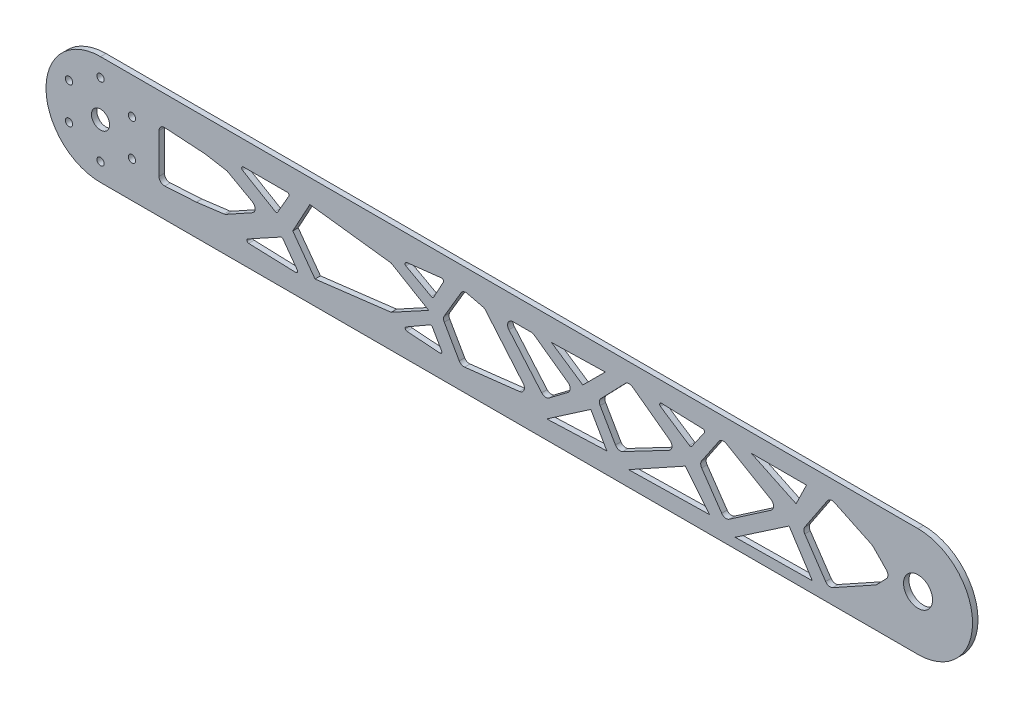
from build123d import *

# Parameters (mm, degrees)
SKETCH1_R           = 2
SKETCH1_R_2         = 5
BOSS_EXTRUDE1_DEPTH = 3
SKETCH2_R           = 8
CUT_EXTRUDE1_DEPTH  = 10
CUT_EXTRUDE2_DEPTH  = 10
FILLET1_R           = 3
FILLET2_R           = 1
FILLET3_R           = 3


with BuildPart() as part:
    # Sketch1 → Boss-Extrude1 (new body)
    with BuildSketch(Plane.XY):
        with BuildLine():
            Line((0, 30), (450, 30))
            ThreePointArc((450, 30), (480, 0), (450, -30))
            Line((450, -30), (0, -30))
            ThreePointArc((0, -30), (-30, 0), (0, 30))
        make_face()
        with Locations((0, 20)):
            Circle(SKETCH1_R, mode=Mode.SUBTRACT)
        with Locations((17.320508076, 10)):
            Circle(SKETCH1_R, mode=Mode.SUBTRACT)
        with Locations((17.320508076, -10)):
            Circle(SKETCH1_R, mode=Mode.SUBTRACT)
        with Locations((0, -20)):
            Circle(SKETCH1_R, mode=Mode.SUBTRACT)
        Circle(SKETCH1_R_2, mode=Mode.SUBTRACT)
        with Locations((-17.320508076, -10)):
            Circle(SKETCH1_R, mode=Mode.SUBTRACT)
        with Locations((-17.320508076, 10)):
            Circle(SKETCH1_R, mode=Mode.SUBTRACT)
    extrude(amount=BOSS_EXTRUDE1_DEPTH)

    # Sketch2 → Cut-Extrude1 (cut)
    with BuildSketch(Plane(origin=(0, 0, 0), x_dir=(-1, 0, 0), z_dir=(0, 0, -1))):
        with Locations((-450, 0)):
            Circle(SKETCH2_R)
    extrude(amount=-CUT_EXTRUDE1_DEPTH, mode=Mode.SUBTRACT)

    # Sketch4 → Cut-Extrude2 (cut)
    with BuildSketch(Plane.XY.offset(3)):
        Polygon((75.051155, 16.751903708), (104.496414244, 16.751903708), (97.010331386, 3.776026753), align=None)
        Polygon((115.236434087, 17.133628969), (159.994947493, 11.590143364), (180.655213039, -0.618195368), (159.994947493, -11.858002091), (118.085145684, -16.966802955), (105.823337098, -0.177570288), align=None)
        Polygon((189.665526052, 18.578346929), (182.941129647, 6.211814834), (165.368544986, 15.767042135), align=None)
        Polygon((199.599828734, 18.578346929), (188.361345274, -0.440625079), (198.44447832, -18.021795356), (236.21688029, -13.651304452), (211.35817569, 15.767042135), align=None)
        Polygon((220.526900823, 17.172694532), (237.960392272, 17.172694532), (260.559362669, 1.057868841), (244.675514904, -10.943884315), align=None)
        Polygon((265.46656767, 6.211814834), (277.833099766, 18.578346929), (248.220353812, 17.874878196), align=None)
        Polygon((165.368544986, -16.358724589), (182.200526719, -6.705265316), (188.690770328, -18.021795356), align=None)
        Polygon((245.637394842, -19.868271823), (269.887796501, -3.220439984), (278.716640894, -18.61460526), align=None)
        Polygon((290.68321902, -21.539751298), (321.940631216, -4.211371592), (335.206376445, -20.70401156), align=None)
        Polygon((341.992933025, 19.183441398), (329.735187473, 1.057868841), (343.614563911, -19.159806148), (373.065049946, 1.057868841), align=None)
        Polygon((273.877820417, 3.11420529), (290.68321902, 20.542728609), (317.209913689, 1.057868841), (284.881711611, -15.886302486), align=None)
        Polygon((305.30736893, 19.270974689), (333.375882047, 18.324324896), (324.94206251, 6.211814834), align=None)
        Polygon((358.198045962, 20.050204211), (388.597492455, 20.050204211), (382.886534474, 8.292807575), align=None)
        Polygon((349.331047186, -24.428108969), (379.030224427, -4.211371592), (391.830023208, -23.92704923), align=None)
        Polygon((386.543005003, -2.048490112), (401.586425759, 20.569577221), (424.881274354, 9.475873595), (434.601030173, -0.440625079), (426.98326683, -8.340846264), (400.664497987, -22.912566492), align=None)
        Polygon((77.908222084, -18.113128875), (99.959146412, -5.986003719), (109.517710051, -19.216558315), align=None)
        Polygon((32.181427401, 14.045195837), (32.181427401, -14.186471438), (52.8225456, -12.955618238), (68.554424875, -10.943884315), (88.302954178, 0), (69.662476286, 10.346921974), (57.571708379, 12.423629667), align=None)
    extrude(amount=-CUT_EXTRUDE2_DEPTH, mode=Mode.SUBTRACT)

    # Fillet1
    # the kernel refuses this fillet: 3 mm, written as the material it adds along each edge
    with BuildSketch(Plane(origin=(32.181427401, 14.045195837, 3), x_dir=(0, -1, 0), z_dir=(0, 0, -1))) as fillet1_piece_1:
        with BuildLine():
            CenterArc((FILLET1_R * 1.06590295895, -FILLET1_R), FILLET1_R, 90, 93.654267812)
            Line((FILLET1_R * 0.0679361503378, -FILLET1_R * 1.06373577423), (0, 0))
            Line((0, 0), (FILLET1_R * 1.06590295895, 0))
        make_face()
    extrude(amount=3)
    with BuildSketch(Plane(origin=(57.571708379, 12.423629667, 3), x_dir=(-0.9979668086083109, 0.06373577422564991, 0), z_dir=(0, 0, -1))) as fillet1_piece_2:
        with BuildLine():
            CenterArc((FILLET1_R * 0.0532106389046, -FILLET1_R), FILLET1_R, 90, 6.091745071)
            Line((-FILLET1_R * 0.0529101714038, -FILLET1_R * 0.00564675611758), (0, 0))
            Line((0, 0), (FILLET1_R * 0.0532106389046, 0))
        make_face()
    extrude(amount=3)
    with BuildSketch(Plane(origin=(69.662476286, 10.346921974, 3), x_dir=(-0.9855678414202016, 0.16928092024302194, 0), z_dir=(0, 0, -1))) as fillet1_piece_3:
        with BuildLine():
            CenterArc((FILLET1_R * 0.169924527084, -FILLET1_R), FILLET1_R, 90, 19.287684891)
            Line((-FILLET1_R * 0.160386998178, -FILLET1_R * 0.0561280297205), (0, 0))
            Line((0, 0), (FILLET1_R * 0.169924527084, 0))
        make_face()
    extrude(amount=3)
    with BuildSketch(Plane(origin=(88.302954178, 0, 3), x_dir=(-0.8743344213622383, 0.48532393266885154, 0), z_dir=(0, 0, -1))) as fillet1_piece_4:
        with BuildLine():
            CenterArc((FILLET1_R * 1.80303637433, -FILLET1_R), FILLET1_R, 90, 121.972748141)
            Line((FILLET1_R * 0.954736326134, -FILLET1_R * 1.52951584323), (0, 0))
            Line((0, 0), (FILLET1_R * 1.80303637433, 0))
        make_face()
    extrude(amount=3)
    with BuildSketch(Plane(origin=(68.554424875, -10.943884315, 3), x_dir=(0.8746742438686059, 0.4847112203290558, 0), z_dir=(0, 0, -1))) as fillet1_piece_5:
        with BuildLine():
            CenterArc((FILLET1_R * 0.191722072286, -FILLET1_R), FILLET1_R, 90, 21.70633324)
            Line((-FILLET1_R * 0.178127385219, -FILLET1_R * 0.0709083044269), (0, 0))
            Line((0, 0), (FILLET1_R * 0.191722072286, 0))
        make_face()
    extrude(amount=3)
    with BuildSketch(Plane(origin=(52.8225456, -12.955618238, 3), x_dir=(0.9919227581955331, 0.1268433749699441, 0), z_dir=(0, 0, -1))) as fillet1_piece_6:
        with BuildLine():
            CenterArc((FILLET1_R * 0.0338255904119, -FILLET1_R), FILLET1_R, 90, 3.874649837)
            Line((-FILLET1_R * 0.0337482743847, -FILLET1_R * 0.00228572587316), (0, 0))
            Line((0, 0), (FILLET1_R * 0.0338255904119, 0))
        make_face()
    extrude(amount=3)
    with BuildSketch(Plane(origin=(32.181427401, -14.186471438, 3), x_dir=(0, 1, 0), z_dir=(0, 0, -1))) as fillet1_piece_7:
        with BuildLine():
            CenterArc((FILLET1_R * 1.06140748795, FILLET1_R), FILLET1_R, 176.587428992, 93.412571008)
            Line((FILLET1_R * 0.0631806961919, FILLET1_R * 1.05952539143), (0, 0))
            Line((0, 0), (FILLET1_R * 1.06140748795, 0))
        make_face()
    extrude(amount=3)

    # Fillet2
    fillet2_edges = [part.edges().sort_by_distance(p)[0] for p in [
        (188.690770328, -18.021795356, 1.5),
        (165.368544986, -16.358724589, 1.5),
        (182.200526719, -6.705265316, 1.5),
        (97.010331386, 3.776026753, 1.5),
        (75.051155, 16.751903708, 1.5),
        (104.496414244, 16.751903708, 1.5),
        (165.368544986, 15.767042135, 1.5),
        (189.665526052, 18.578346929, 1.5),
        (182.941129647, 6.211814834, 1.5),
        (109.517710051, -19.216558315, 1.5),
        (77.908222084, -18.113128875, 1.5),
        (99.959146412, -5.986003719, 1.5),
        (324.94206251, 6.211814834, 1.5),
        (305.30736893, 19.270974689, 1.5),
        (333.375882047, 18.324324896, 1.5),
    ]]
    fillet(fillet2_edges, radius=FILLET2_R)

    # Fillet3
    fillet3_edges = [part.edges().sort_by_distance(p)[0] for p in [
        (244.675514904, -10.943884315, 1.5),
        (220.526900823, 17.172694532, 1.5),
        (237.960392272, 17.172694532, 1.5),
        (260.559362669, 1.057868841, 1.5),
        (199.599828734, 18.578346929, 1.5),
        (211.35817569, 15.767042135, 1.5),
        (236.21688029, -13.651304452, 1.5),
        (198.44447832, -18.021795356, 1.5),
        (188.361345274, -0.440625079, 1.5),
        (400.664497987, -22.912566492, 1.5),
        (386.543005003, -2.048490112, 1.5),
        (401.586425759, 20.569577221, 1.5),
        (424.881274354, 9.475873595, 1.5),
        (434.601030173, -0.440625079, 1.5),
        (426.98326683, -8.340846264, 1.5),
        (341.992933025, 19.183441398, 1.5),
        (373.065049946, 1.057868841, 1.5),
        (343.614563911, -19.159806148, 1.5),
        (329.735187473, 1.057868841, 1.5),
        (284.881711611, -15.886302486, 1.5),
        (273.877820417, 3.11420529, 1.5),
        (290.68321902, 20.542728609, 1.5),
        (317.209913689, 1.057868841, 1.5),
    ]]
    fillet(fillet3_edges, radius=FILLET3_R)


solid = part.part
